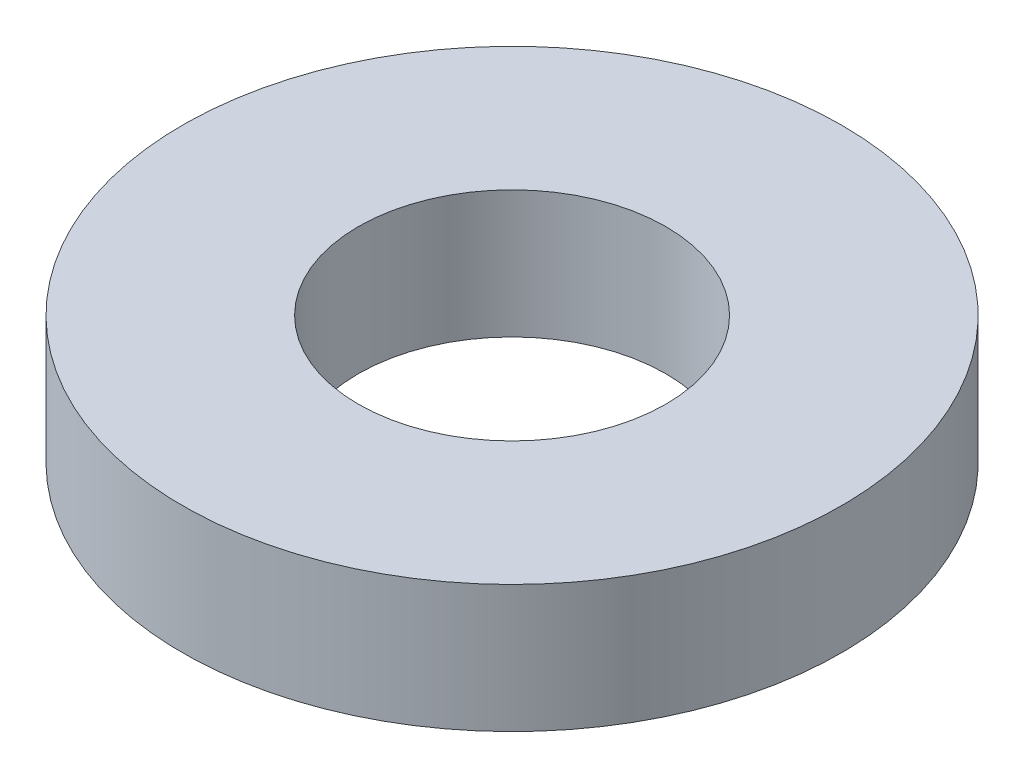
from build123d import *

# Parameters (mm, degrees)
SKETCH1_R           = 75
BOSS_EXTRUDE1_DEPTH = 29
SKETCH2_R           = 35
CUT_EXTRUDE1_DEPTH  = 110.959083299


with BuildPart() as part:
    # Sketch1 → Boss-Extrude1 (new body)
    with BuildSketch(Plane(origin=(0, 0, 0), x_dir=(1, 0, 0), z_dir=(0, 1, 0))):
        Circle(SKETCH1_R)
    extrude(amount=BOSS_EXTRUDE1_DEPTH)

    # Sketch2 → Cut-Extrude1 (cut, through all)
    with BuildSketch(Plane(origin=(0, 0, 0), x_dir=(1, 0, 0), z_dir=(0, 1, 0))):
        Circle(SKETCH2_R)
    extrude(amount=CUT_EXTRUDE1_DEPTH, mode=Mode.SUBTRACT)


solid = part.part
